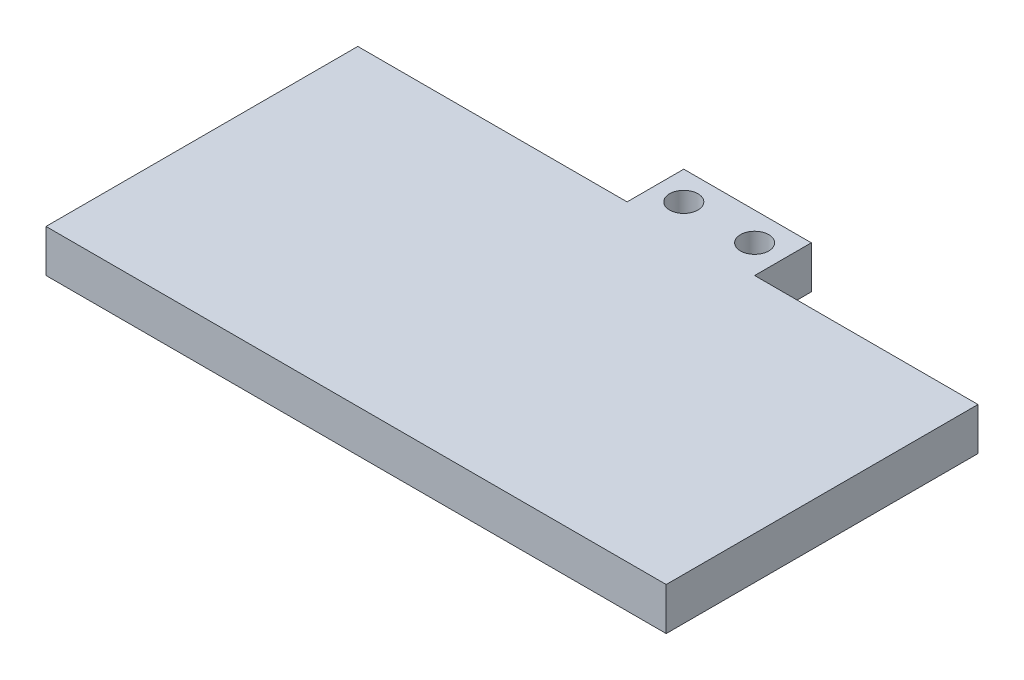
from build123d import *

# Parameters (mm, degrees)
SKETCH1_W           = 277.876
SKETCH1_H           = 139.7
BOSS_EXTRUDE2_DEPTH = 19.05
SKETCH2_W           = 57.15
SKETCH2_H           = 25.4
SKETCH2_R           = 6.35
BOSS_EXTRUDE3_DEPTH = 19.05


with BuildPart() as part:
    # Sketch1 → Boss-Extrude2 (new body)
    with BuildSketch(Plane(origin=(0, 0, 0), x_dir=(1, 0, 0), z_dir=(0, 1, 0))):
        with Locations((138.938, 69.85)):
            Rectangle(SKETCH1_W, SKETCH1_H)
    extrude(amount=BOSS_EXTRUDE2_DEPTH)

    # Sketch2 → Boss-Extrude3 (add)
    with BuildSketch(Plane(origin=(0, 19.05, 0), x_dir=(1, 0, 0), z_dir=(0, 1, 0))):
        with Locations((149.225, 152.4)):
            Rectangle(SKETCH2_W, SKETCH2_H)
        with Locations((133.35, 152.4)):
            Circle(SKETCH2_R, mode=Mode.SUBTRACT)
        with Locations((165.1, 152.4)):
            Circle(SKETCH2_R, mode=Mode.SUBTRACT)
    extrude(amount=-BOSS_EXTRUDE3_DEPTH)


solid = part.part
